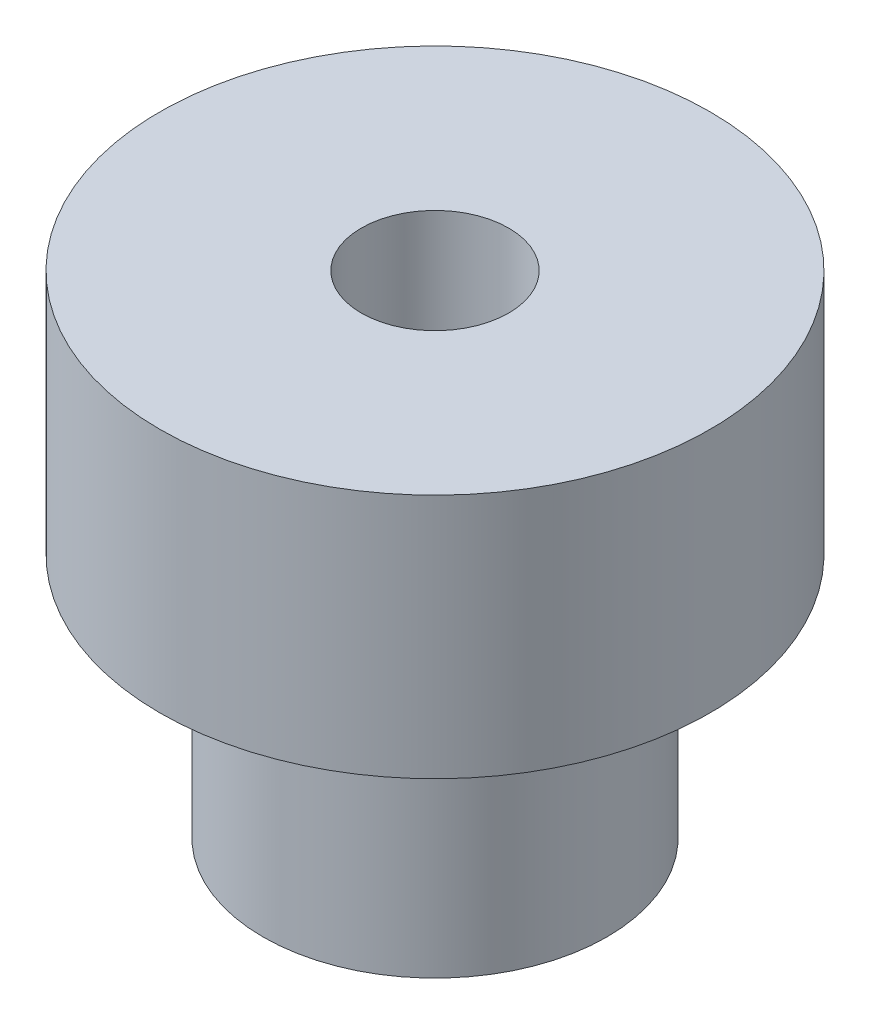
from build123d import *

# Parameters (mm, degrees)
SKETCH1_R           = 5.6
SKETCH1_R_2         = 1.5
BOSS_EXTRUDE1_DEPTH = 5
BOSS_EXTRUDE2_START = 5
SKETCH2_R           = 3.5
SKETCH2_R_2         = 1.5
BOSS_EXTRUDE2_DEPTH = 5


with BuildPart() as part:
    # Sketch1 → Boss-Extrude1 (new body)
    with BuildSketch(Plane(origin=(0, 0, 0), x_dir=(1, 0, 0), z_dir=(0, 1, 0))):
        Circle(SKETCH1_R)
        Circle(SKETCH1_R_2, mode=Mode.SUBTRACT)
    extrude(amount=BOSS_EXTRUDE1_DEPTH)

    # Sketch2 → Boss-Extrude2 (add)
    with BuildSketch(Plane.XZ.offset(BOSS_EXTRUDE2_START)):
        Circle(SKETCH2_R)
        Circle(SKETCH2_R_2, mode=Mode.SUBTRACT)
    extrude(amount=-BOSS_EXTRUDE2_DEPTH)


solid = part.part
